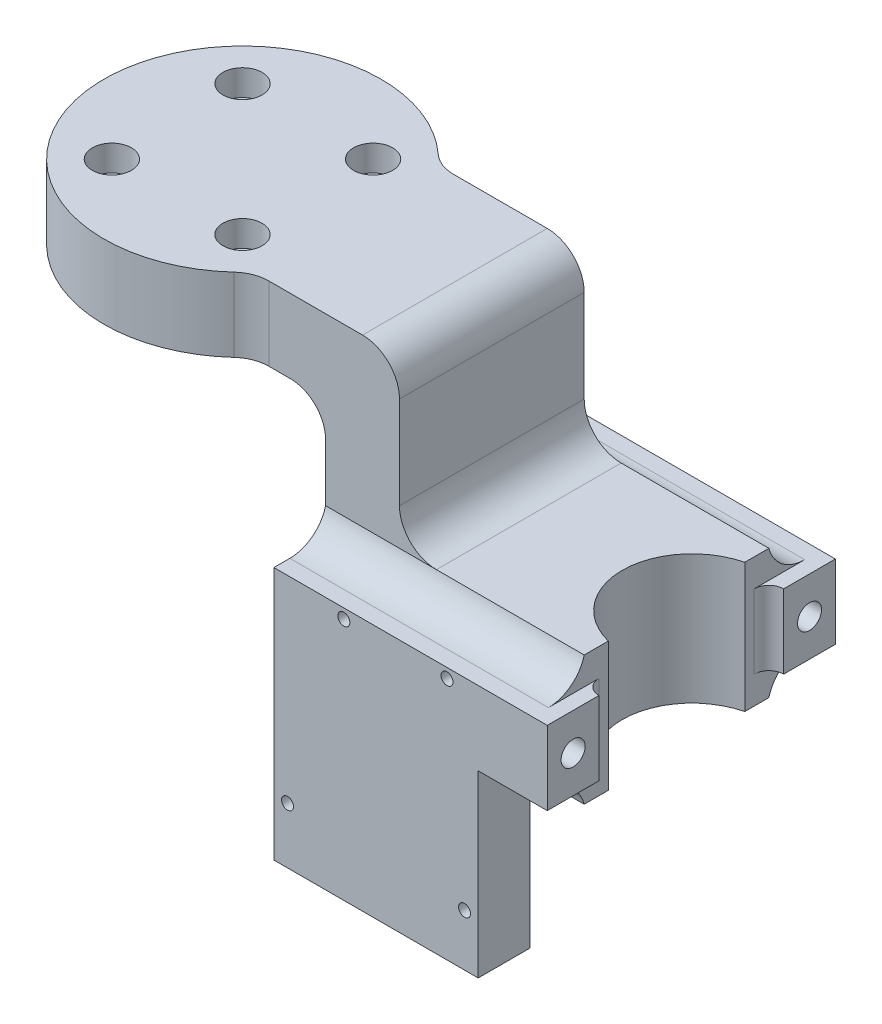
from build123d import *
from build123d.topology import SkipClean

# Parameters (mm, degrees)
SKETCH1_W                = 50
SKETCH1_H                = 50
SKETCH1_RX               = 19.7
SKETCH1_RY               = 19.1
BOSS_EXTRUDE1_DEPTH      = 35
SKETCH2_W                = 30
SKETCH2_H                = 50
CUT_EXTRUDE1_DEPTH       = 35
SKETCH3_W                = 13
SKETCH3_H                = 50
BOSS_EXTRUDE2_DEPTH      = 20
SKETCH4_R                = 1.5
CUT_EXTRUDE2_DEPTH       = 64.639610377
SKETCH5_W                = 36.974567712
SKETCH5_H                = 20
CUT_EXTRUDE3_DEPTH       = 20
BOSS_EXTRUDE3_DEPTH      = 4
BOSS_EXTRUDE3_DEPTH_BACK = 20
SKETCH6_W                = 14
SKETCH6_H                = 20
SKETCH6_R                = 3.25
SKETCH7_R                = 5.3
SKETCH7_R_2              = 3
CUT_EXTRUDE4_DEPTH       = 6
SKETCH8_W                = 13
SKETCH8_H                = 13.025432288
CUT_EXTRUDE5_DEPTH       = 30
FILLET6_R                = 4
FILLET5_R                = 10
SKETCH9_R                = 5.3
BOSS_EXTRUDE4_DEPTH      = 50
SKETCH10_W               = 20
SKETCH10_H               = 50
BOSS_EXTRUDE5_DEPTH      = 45
FILLET7_R                = 10
SKETCH11_W               = 50
SKETCH11_H               = 20
BOSS_EXTRUDE6_DEPTH      = 85
SKETCH13_R               = 37.5
BOSS_EXTRUDE7_DEPTH      = 20
FILLET8_R                = 9.5
CUT_EXTRUDE6_DEPTH       = 85
FILLET9_R                = 10
FILLET10_R               = 10
SKETCH14_R               = 3.25
CUT_EXTRUDE7_DEPTH       = 85
SKETCH15_R               = 5.3
CUT_EXTRUDE8_DEPTH       = 7
SKETCH16_R               = 3.25
BOSS_EXTRUDE9_DEPTH      = 56
SKETCH16_3_R             = 3.25
CUT_EXTRUDE11_DEPTH      = 10
SKETCH17_W               = 15
SKETCH17_H               = 14
BOSS_EXTRUDE10_DEPTH     = 7.5
SKETCH18_W               = 15
SKETCH18_H               = 14
BOSS_EXTRUDE11_DEPTH     = 41.08
BOSS_EXTRUDE12_REACH     = 181.937
SKETCH20_W               = 40.3
SKETCH20_H               = 14
SKETCH21_R               = 1.61925
CUT_EXTRUDE13_DEPTH      = 7


# Some blends are built 0.0001 mm under size
with BuildPart() as part:
    # Sketch1 → Boss-Extrude1 (new body)
    with BuildSketch(Plane(origin=(0, 0, 0), x_dir=(1, 0, 0), z_dir=(0, 1, 0))):
        Rectangle(SKETCH1_W, SKETCH1_H)
        with Locations((0, 0)):
            Ellipse(SKETCH1_RX, SKETCH1_RY, mode=Mode.SUBTRACT)
    extrude(amount=BOSS_EXTRUDE1_DEPTH)

    # Sketch2 → Cut-Extrude1 (cut)
    with BuildSketch(Plane(origin=(0, 35, 0), x_dir=(1, 0, 0), z_dir=(0, 1, 0))):
        with Locations((10, 0)):
            Rectangle(SKETCH2_W, SKETCH2_H)
    extrude(amount=-CUT_EXTRUDE1_DEPTH, mode=Mode.SUBTRACT)

    # Sketch3 → Boss-Extrude2 (add)
    with BuildSketch(Plane(origin=(0, 35, 0), x_dir=(1, 0, 0), z_dir=(0, 1, 0))):
        with Locations((-18.5, 0)):
            Rectangle(SKETCH3_W, SKETCH3_H)
    extrude(amount=BOSS_EXTRUDE2_DEPTH)

    # Sketch4 → Cut-Extrude2 (cut, through all)
    with BuildSketch(Plane.ZY.offset(25)):
        with Locations((18.474567712, 50)):
            Circle(SKETCH4_R)
    extrude(amount=-CUT_EXTRUDE2_DEPTH, mode=Mode.SUBTRACT)

    # Sketch5 → Cut-Extrude3 (cut)
    with BuildSketch(Plane(origin=(-12, 55, -25), x_dir=(0, 0, 1), z_dir=(-1, 0, 0))):
        with Locations((18.487283856, -10)):
            Rectangle(SKETCH5_W, SKETCH5_H)
    extrude(amount=CUT_EXTRUDE3_DEPTH, mode=Mode.SUBTRACT)

    # Sketch6 → Boss-Extrude3 (add, two sides: drawn at the far end of the back side and taken through both)
    # profile 1 of 2: a face of its own
    with BuildSketch(Plane(origin=(-5, 0, 0), x_dir=(0, 0, -1), z_dir=(1, 0, 0)).offset(-BOSS_EXTRUDE3_DEPTH_BACK)):
        with Locations((-32, 17.5)):
            Rectangle(SKETCH6_W, SKETCH6_H)
        with Locations((-32, 17.5)):
            Circle(SKETCH6_R, mode=Mode.SUBTRACT)
    # profile 2 of 2: a face of its own
    with BuildSketch(Plane(origin=(-5, 0, 0), x_dir=(0, 0, -1), z_dir=(1, 0, 0)).offset(-BOSS_EXTRUDE3_DEPTH_BACK)):
        with Locations((32, 17.5)):
            Rectangle(SKETCH6_W, SKETCH6_H)
        with Locations((32, 17.5)):
            Circle(SKETCH6_R, mode=Mode.SUBTRACT)
    extrude(amount=BOSS_EXTRUDE3_DEPTH + BOSS_EXTRUDE3_DEPTH_BACK)

    # Sketch7 → Cut-Extrude4 (cut)
    with BuildSketch(Plane.ZY.offset(25)):
        with Locations((-32, 17.5)):
            Circle(SKETCH7_R)
        with Locations((32, 17.5)):
            Circle(SKETCH7_R)
        with Locations((18.474567712, 50)):
            Circle(SKETCH7_R_2)
    extrude(amount=-CUT_EXTRUDE4_DEPTH, mode=Mode.SUBTRACT)

    # Sketch8 → Cut-Extrude5 (cut)
    with BuildSketch(Plane(origin=(0, 35, 0), x_dir=(1, 0, 0), z_dir=(0, 1, 0))):
        with Locations((-18.5, -18.487283856)):
            Rectangle(SKETCH8_W, SKETCH8_H)
    extrude(amount=CUT_EXTRUDE5_DEPTH, mode=Mode.SUBTRACT)

    # Fillet6
    fillet6_edges = [part.edges().sort_by_distance(p)[0] for p in [
        (-5, 17.5, 25),
        (-5, 17.5, -25),
    ]]
    fillet(fillet6_edges, radius=FILLET6_R - 0.0001)  # a hair under: the kernel refuses the full size

    # Fillet5
    # the kernel refuses this fillet: 10 mm, written as the material it adds along each edge
    with BuildSketch(Plane(origin=(-5, 7.5, 25), x_dir=(0, -1, 0), z_dir=(-1, 0, 0))) as fillet5_piece_1:
        with BuildLine():
            CenterArc((10, 9.682458366), FILLET5_R, 180, 75.522487814)
            Line((0, 9.682458366), (0, 0))
            Line((0, 0), (7.5, 0))
        make_face()
    extrude(amount=20)
    with BuildSketch(Plane(origin=(-5, 27.5, 25), x_dir=(0, 0, 1), z_dir=(-1, 0, 0)), Plane(origin=(-5, 7.5, -25), x_dir=(0, 0, -1), z_dir=(-1, 0, 0))) as fillet5_piece_2:
        with BuildLine():
            CenterArc((9.682458366, 10), FILLET5_R, 194.477512186, 75.522487814)
            Line((0, 7.5), (0, 0))
            Line((0, 0), (9.682458366, 0))
        make_face()
    extrude(amount=20)
    with BuildSketch(Plane(origin=(-5, 27.5, -25), x_dir=(0, 0, -1), z_dir=(-1, 0, 0))) as fillet5_piece_3:
        with BuildLine():
            CenterArc((9.682458366, -10), FILLET5_R, 90, 75.522487814)
            Line((0, -7.5), (0, 0))
            Line((0, 0), (9.682458366, 0))
        make_face()
    extrude(amount=20)

    # Sketch9 → Boss-Extrude4 (add)
    with BuildSketch(Plane.ZY.offset(25)):
        with BuildLine():
            Line((39, 27.5), (34.682458366, 27.5))
            ThreePointArc((34.682458366, 27.5), (28.558734009, 29.59430585), (25, 35))
            Line((25, 35), (-25, 35))
            ThreePointArc((-25, 35), (-28.558734009, 29.59430585), (-34.682458366, 27.5))
            Line((-34.682458366, 27.5), (-39, 27.5))
            Line((-39, 27.5), (-39, 7.5))
            Line((-39, 7.5), (-34.682458366, 7.5))
            ThreePointArc((-34.682458366, 7.5), (-28.558734009, 5.40569415), (-25, 0))
            Line((-25, 0), (25, 0))
            ThreePointArc((25, 0), (28.558734009, 5.40569415), (34.682458366, 7.5))
            Line((34.682458366, 7.5), (39, 7.5))
            Line((39, 7.5), (39, 27.5))
        make_face()
        with Locations((32, 17.5)):
            Circle(SKETCH9_R, mode=Mode.SUBTRACT)
        with Locations((-32, 17.5)):
            Circle(SKETCH9_R, mode=Mode.SUBTRACT)
    extrude(amount=BOSS_EXTRUDE4_DEPTH)

    # Sketch10 → Boss-Extrude5 (add)
    with SkipClean():  # the faces are left unmerged after this step: merging them gives an invalid solid
        with BuildSketch(Plane(origin=(0, 35, 0), x_dir=(1, 0, 0), z_dir=(0, 1, 0))):
            with Locations((-65, 0)):
                Rectangle(SKETCH10_W, SKETCH10_H)
        extrude(amount=BOSS_EXTRUDE5_DEPTH)

    # Fillet7
    fillet7_edges = [part.edges().sort_by_distance(p)[0] for p in [
        (-55, 35, 0),
    ]]
    fillet(fillet7_edges, radius=FILLET7_R)

    # Sketch11 → Boss-Extrude6 (add)
    with SkipClean():  # the faces are left unmerged after this step: merging them gives an invalid solid
        with BuildSketch(Plane.ZY.offset(75)):
            with Locations((0, 70)):
                Rectangle(SKETCH11_W, SKETCH11_H)
        extrude(amount=BOSS_EXTRUDE6_DEPTH)

    # Sketch13 → Boss-Extrude7 (add)
    with SkipClean():  # the faces are left unmerged after this step: merging them gives an invalid solid
        with BuildSketch(Plane(origin=(0, 80, 0), x_dir=(1, 0, 0), z_dir=(0, 1, 0))):
            with Locations((-122.5, 0)):
                Circle(SKETCH13_R)
        extrude(amount=-BOSS_EXTRUDE7_DEPTH)

    # Fillet8
    fillet8_edges = [part.edges().sort_by_distance(p)[0] for p in [
        (-75, 60, 0),
    ]]
    fillet(fillet8_edges, radius=FILLET8_R)

    # Sketch13<3> → Cut-Extrude6 (cut)
    with SkipClean():  # the faces are left unmerged after this step: merging them gives an invalid solid
        with BuildSketch(Plane(origin=(0, 80, 0), x_dir=(1, 0, 0), z_dir=(0, 1, 0))):
            with BuildLine():
                ThreePointArc((-150.450849719, -25), (-157.531463473, -13.380828335), (-160, 6.6e-08))
                Line((-160, 6.6e-08), (-160, -25))
                Line((-160, -25), (-150.450849719, -25))
            make_face()
            with BuildLine():
                Line((-150.450849719, 25), (-160, 25))
                Line((-160, 25), (-160, -2.4e-07))
                ThreePointArc((-160, -2.4e-07), (-157.531463504, 13.380828254), (-150.450849719, 25))
            make_face()
        extrude(amount=-CUT_EXTRUDE6_DEPTH, mode=Mode.SUBTRACT)

    # Fillet9
    fillet9_edges = [part.edges().sort_by_distance(p)[0] for p in [
        (-94.549150281, 70, 25),
        (-94.549150281, 70, -25),
    ]]
    fillet(fillet9_edges, radius=FILLET9_R)

    # Fillet10
    fillet10_edges = [part.edges().sort_by_distance(p)[0] for p in [
        (-55, 80, 0),
    ]]
    fillet(fillet10_edges, radius=FILLET10_R)

    # Sketch14 → Cut-Extrude7 (cut)
    with SkipClean():  # the faces are left unmerged after this step: merging them gives an invalid solid
        with BuildSketch(Plane(origin=(0, 80, 0), x_dir=(1, 0, 0), z_dir=(0, 1, 0))):
            with Locations(Location((-140.17766953, 17.67766953, 0), (0, 0, 270))):
                Circle(SKETCH14_R)
            with Locations(Location((-140.17766953, -17.67766953, 0), (0, 0, 270))):
                Circle(SKETCH14_R)
            with Locations(Location((-104.82233047, -17.67766953, 0), (0, 0, 270))):
                Circle(SKETCH14_R)
            with Locations(Location((-104.82233047, 17.67766953, 0), (0, 0, 270))):
                Circle(SKETCH14_R)
        extrude(amount=-CUT_EXTRUDE7_DEPTH, mode=Mode.SUBTRACT)

    # Sketch15 → Cut-Extrude8 (cut)
    with SkipClean():  # the faces are left unmerged after this step: merging them gives an invalid solid
        with BuildSketch(Plane(origin=(0, 80, 0), x_dir=(1, 0, 0), z_dir=(0, 1, 0))):
            with Locations(Location((-140.17766953, 17.67766953, 0), (0, 0, 270))):
                Circle(SKETCH15_R)
            with Locations(Location((-140.17766953, -17.67766953, 0), (0, 0, 270))):
                Circle(SKETCH15_R)
            with Locations(Location((-104.82233047, -17.67766953, 0), (0, 0, 270))):
                Circle(SKETCH15_R)
            with Locations(Location((-104.82233047, 17.67766953, 0), (0, 0, 270))):
                Circle(SKETCH15_R)
        extrude(amount=-CUT_EXTRUDE8_DEPTH, mode=Mode.SUBTRACT)

    # Sketch16 → Boss-Extrude9 (add)
    # profile 1 of 2: a face of its own
    with SkipClean():  # the faces are left unmerged after this step: merging them gives an invalid solid
        with BuildSketch(Plane.ZY.offset(75)):
            Polygon((-25.937822174, 17.5), (-28.968911087, 22.75), (-35.031088913, 22.75), (-38.062177826, 17.5), (-35.031088913, 12.25), (-28.968911087, 12.25), align=None)
            with Locations(Location((-32, 17.5, 0), (0, 0, 180))):
                Circle(SKETCH16_R, mode=Mode.SUBTRACT)
        # profile 2 of 2: a face of its own
        with BuildSketch(Plane.ZY.offset(75)):
            Polygon((25.937822174, 17.5), (28.968911087, 12.25), (35.031088913, 12.25), (38.062177826, 17.5), (35.031088913, 22.75), (28.968911087, 22.75), align=None)
            with Locations(Location((32, 17.5, 0), (0, 0, 180))):
                Circle(SKETCH16_R, mode=Mode.SUBTRACT)
        extrude(amount=-BOSS_EXTRUDE9_DEPTH)

    # Sketch16<3> → Cut-Extrude11 (cut)
    # profile 1 of 2: a face of its own
    with SkipClean():  # the faces are left unmerged after this step: merging them gives an invalid solid
        with BuildSketch(Plane.ZY.offset(75)):
            Polygon((-25.937822174, 17.5), (-28.968911087, 22.75), (-35.031088913, 22.75), (-38.062177826, 17.5), (-35.031088913, 12.25), (-28.968911087, 12.25), align=None)
            with Locations(Location((-32, 17.5, 0), (0, 0, 180))):
                Circle(SKETCH16_3_R, mode=Mode.SUBTRACT)
        # profile 2 of 2: a face of its own
        with BuildSketch(Plane.ZY.offset(75)):
            Polygon((25.937822174, 17.5), (28.968911087, 12.25), (35.031088913, 12.25), (38.062177826, 17.5), (35.031088913, 22.75), (28.968911087, 22.75), align=None)
            with Locations(Location((32, 17.5, 0), (0, 0, 180))):
                Circle(SKETCH16_3_R, mode=Mode.SUBTRACT)
        extrude(amount=-CUT_EXTRUDE11_DEPTH, mode=Mode.SUBTRACT)

    # Sketch17 → Boss-Extrude10 (add)
    with SkipClean():  # the faces are left unmerged after this step: merging them gives an invalid solid
        with BuildSketch(Plane.XZ):
            with Locations((-67.5, 32)):
                Rectangle(SKETCH17_W, SKETCH17_H)
        extrude(amount=-BOSS_EXTRUDE10_DEPTH)

    # Sketch18 → Boss-Extrude11 (add)
    with SkipClean():  # the faces are left unmerged after this step: merging them gives an invalid solid
        with BuildSketch(Plane.XZ):
            with Locations((-67.5, 32)):
                Rectangle(SKETCH18_W, SKETCH18_H)
        extrude(amount=BOSS_EXTRUDE11_DEPTH)

    # Boss-Extrude12: up to this face of the body (flat: up to its plane)
    boss_extrude12_end = Plane(part.part.faces().sort_by_distance((-67.5, -41.08, 32))[0])
    # Sketch20 → Boss-Extrude12 (add, up to the picked face)
    with BuildSketch(Plane.XZ.offset(-7.5), mode=Mode.PRIVATE) as boss_extrude12_sk1:
        with Locations((-39.85, 32)):
            Rectangle(SKETCH20_W, SKETCH20_H)
    boss_extrude12_tool1 = split(extrude(boss_extrude12_sk1.sketch, amount=BOSS_EXTRUDE12_REACH, mode=Mode.PRIVATE), bisect_by=boss_extrude12_end, keep=Keep.BOTH, mode=Mode.PRIVATE)
    add(boss_extrude12_tool1.solids().sort_by(Axis((-39.85, 7.5, 32), (0, -1, 0)))[0])

    # Sketch21 → Cut-Extrude13 (cut)
    with SkipClean():  # the faces are left unmerged after this step: merging them gives an invalid solid
        with BuildSketch(Plane.XY.offset(39)):
            with Locations((-56.06855, 24.86475)):
                Circle(SKETCH21_R)
            with Locations((-28.14125, 24.86475)):
                Circle(SKETCH21_R)
            with Locations((-71.30855, -25.92255)):
                Circle(SKETCH21_R)
            with Locations((-23.39145, -27.06555)):
                Circle(SKETCH21_R)
        extrude(amount=-CUT_EXTRUDE13_DEPTH, mode=Mode.SUBTRACT)


solid = part.part
